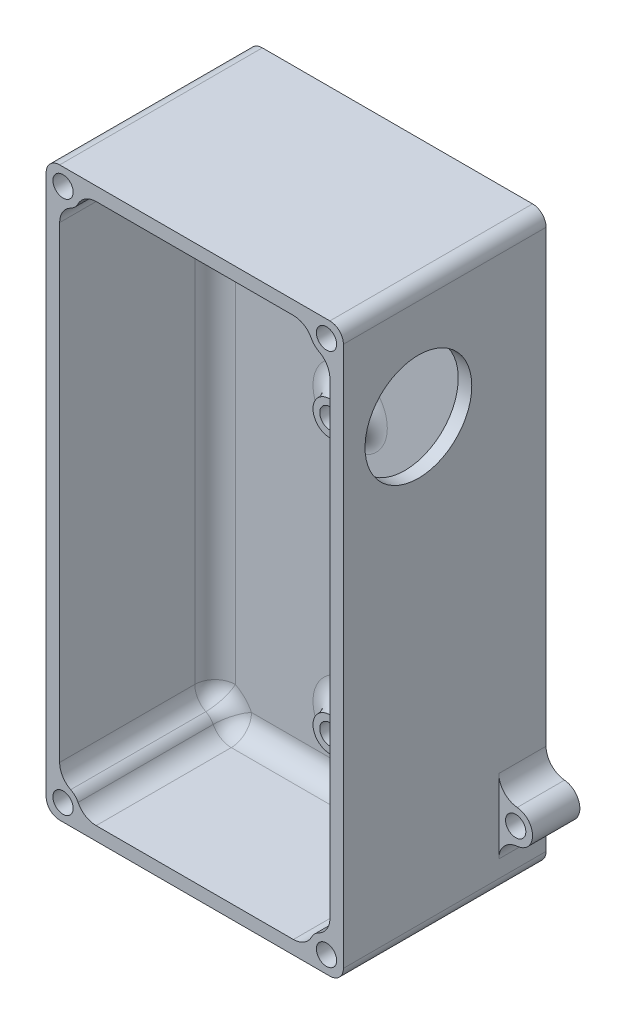
from build123d import *

# Parameters (mm, degrees)
SKETCH3_R          = 1.5
BASE_DEPTH         = 7
WALLS_START        = 7
SKETCH3_3_R        = 1.5
WALLS_DEPTH        = 23
STANDOFFS_START    = 7
SKETCH3_4_R        = 2.5
SKETCH3_4_R_2      = 1.5
STANDOFFS_DEPTH    = 3
INTERNAL_FILLET_R  = 3
EXTERNAL_FILLET_R  = 3
SKETCH5_R          = 7.9
CUT_EXTRUDE1_DEPTH = 10


# Some blends are built 0.0001 mm under size
with BuildPart() as part:
    # Sketch3 → base (new body)
    with BuildSketch(Plane.XY):
        with BuildLine():
            ThreePointArc((-4.5, 74.5), (-7, 72), (-4.5, 69.5))
            Line((-4.5, 69.5), (-2, 69.5))
            Line((-2, 69.5), (-2, 0))
            ThreePointArc((-2, 0), (-1.414213562, -1.414213562), (0, -2))
            Line((0, -2), (40, -2))
            ThreePointArc((40, -2), (41.414213562, -1.414213562), (42, 0))
            Line((42, 0), (42, 5.5))
            Line((42, 5.5), (44.5, 5.5))
            ThreePointArc((44.5, 5.5), (47, 8), (44.5, 10.5))
            Line((44.5, 10.5), (42, 10.5))
            Line((42, 10.5), (42, 80))
            ThreePointArc((42, 80), (41.414213562, 81.414213562), (40, 82))
            Line((40, 82), (0, 82))
            ThreePointArc((0, 82), (-1.414213562, 81.414213562), (-2, 80))
            Line((-2, 80), (-2, 74.5))
            Line((-2, 74.5), (-4.5, 74.5))
        make_face()
        with Locations((44.5, 8)):
            Circle(SKETCH3_R, mode=Mode.SUBTRACT)
        with Locations((-4.5, 72)):
            Circle(SKETCH3_R, mode=Mode.SUBTRACT)
    extrude(amount=BASE_DEPTH)

    # Sketch3<3> → walls (add)
    with BuildSketch(Plane.XY.offset(WALLS_START)):
        with BuildLine():
            Line((-2, 74.5), (-2, 69.5))
            Line((-2, 69.5), (-2, 0))
            ThreePointArc((-2, 0), (-1.414213562, -1.414213562), (0, -2))
            Line((0, -2), (40, -2))
            ThreePointArc((40, -2), (41.414213562, -1.414213562), (42, 0))
            Line((42, 0), (42, 5.5))
            Line((42, 5.5), (42, 10.5))
            Line((42, 10.5), (42, 80))
            ThreePointArc((42, 80), (41.414213562, 81.414213562), (40, 82))
            Line((40, 82), (0, 82))
            ThreePointArc((0, 82), (-1.414213562, 81.414213562), (-2, 80))
            Line((-2, 80), (-2, 74.5))
        make_face()
        with BuildLine():
            ThreePointArc((0.00181331, 1.914853357), (1.366810234, 1.724189535), (2, 0.5))
            ThreePointArc((2, 0.5), (1.978560116, 0.247294673), (1.914853357, 0.00181331))
            ThreePointArc((1.914853357, 0.00181331), (-0.560660172, -0.560660172), (0.00181331, 1.914853357))
        make_face(mode=Mode.SUBTRACT)
        with Locations((39.5, 0.5)):
            Circle(SKETCH3_3_R, mode=Mode.SUBTRACT)
        with Locations((0.5, 79.5)):
            Circle(SKETCH3_3_R, mode=Mode.SUBTRACT)
        with BuildLine():
            ThreePointArc((0, 77.050510257), (2.267766953, 77.732233047), (2.949489743, 80))
            Line((2.949489743, 80), (37.050510257, 80))
            ThreePointArc((37.050510257, 80), (37.732233047, 77.732233047), (40, 77.050510257))
            Line((40, 77.050510257), (40, 2.949489743))
            ThreePointArc((40, 2.949489743), (37.732233047, 2.267766953), (37.050510257, 0))
            Line((37.050510257, 0), (2.949489743, 0))
            ThreePointArc((2.949489743, 0), (2.267766953, 2.267766953), (0, 2.949489743))
            Line((0, 2.949489743), (0, 77.050510257))
        make_face(mode=Mode.SUBTRACT)
        with Locations((39.5, 79.5)):
            Circle(SKETCH3_3_R, mode=Mode.SUBTRACT)
    extrude(amount=WALLS_DEPTH)

    # Sketch3<4> → standoffs (add)
    # profile 1 of 2: a face of its own
    with BuildSketch(Plane.XY.offset(STANDOFFS_START)):
        with Locations((20, 49.5)):
            Circle(SKETCH3_4_R)
        with Locations((20, 49.5)):
            Circle(SKETCH3_4_R_2, mode=Mode.SUBTRACT)
    # profile 2 of 2: a face of its own
    with BuildSketch(Plane.XY.offset(STANDOFFS_START)):
        with Locations((20, 9)):
            Circle(SKETCH3_4_R)
        with Locations((20, 9)):
            Circle(SKETCH3_4_R_2, mode=Mode.SUBTRACT)
    extrude(amount=STANDOFFS_DEPTH)

    # Internal Fillet
    internal_fillet_edges = [part.edges().sort_by_distance(p)[0] for p in [
        (17.5, 49.5, 7),
        (17.5, 9, 7),
        (40, 40, 7),
        (20, 80, 7),
        (0, 40, 7),
        (0, 2.949489743, 18.5),
        (2.267766953, 2.267766953, 7),
        (2.949489743, 0, 18.5),
        (20, 0, 7),
        (37.050510257, 0, 18.5),
        (37.732233047, 2.267766953, 7),
        (40, 2.949489743, 18.5),
        (40, 77.050510257, 18.5),
        (37.732233047, 77.732233047, 7),
        (37.050510257, 80, 18.5),
        (2.949489743, 80, 18.5),
        (2.267766953, 77.732233047, 7),
        (0, 77.050510257, 18.5),
    ]]
    fillet(internal_fillet_edges, radius=INTERNAL_FILLET_R - 0.0001)  # a hair under: the kernel refuses the full size

    # External Fillet
    # the kernel refuses this fillet: 3 mm, written as the material it adds along each edge
    with BuildSketch(Plane(origin=(42, 5.5, 0), x_dir=(0, -1, 0), z_dir=(0, 0, 1)), Plane(origin=(-2, 74.5, 0), x_dir=(0, 1, 0), z_dir=(0, 0, 1))) as external_fillet_piece_1:
        with BuildLine():
            CenterArc((2.977225575, 3), EXTERNAL_FILLET_R, 185.21590857, 84.78409143)
            Line((-0.010352011, 2.727272727), (-0.30910977, 2.7))
            ThreePointArc((-0.30910977, 2.7), (-0.3, 2.5), (-0.3, 0))
            Line((-0.3, 0), (0, -0.3))
            Line((0, -0.3), (2.977225575, -0.3))
            Line((2.977225575, -0.3), (2.977225575, 0))
        make_face()
    extrude(amount=7)
    with BuildSketch(Plane(origin=(42, 10.5, 0), x_dir=(0, 1, 0), z_dir=(0, 0, 1)), Plane(origin=(-2, 69.5, 0), x_dir=(0, -1, 0), z_dir=(0, 0, 1))) as external_fillet_piece_2:
        with BuildLine():
            CenterArc((2.977225575, -3), EXTERNAL_FILLET_R, 90, 84.78409143)
            Line((-0.010352011, -2.727272727), (-0.30910977, -2.7))
            ThreePointArc((-0.30910977, -2.7), (-0.3, -2.5), (-0.3, 0))
            Line((-0.3, 0), (0, 0.3))
            Line((0, 0.3), (2.977225575, 0.3))
            Line((2.977225575, 0.3), (2.977225575, 0))
        make_face()
    extrude(amount=7)

    # Sketch5 → Cut-Extrude1 (cut)
    with BuildSketch(Plane.ZY.offset(-40)):
        with Locations(Location((18.9, 65.168153045, 0), (0, 0, 270))):
            Circle(SKETCH5_R)
    extrude(amount=-CUT_EXTRUDE1_DEPTH, mode=Mode.SUBTRACT)


solid = part.part
